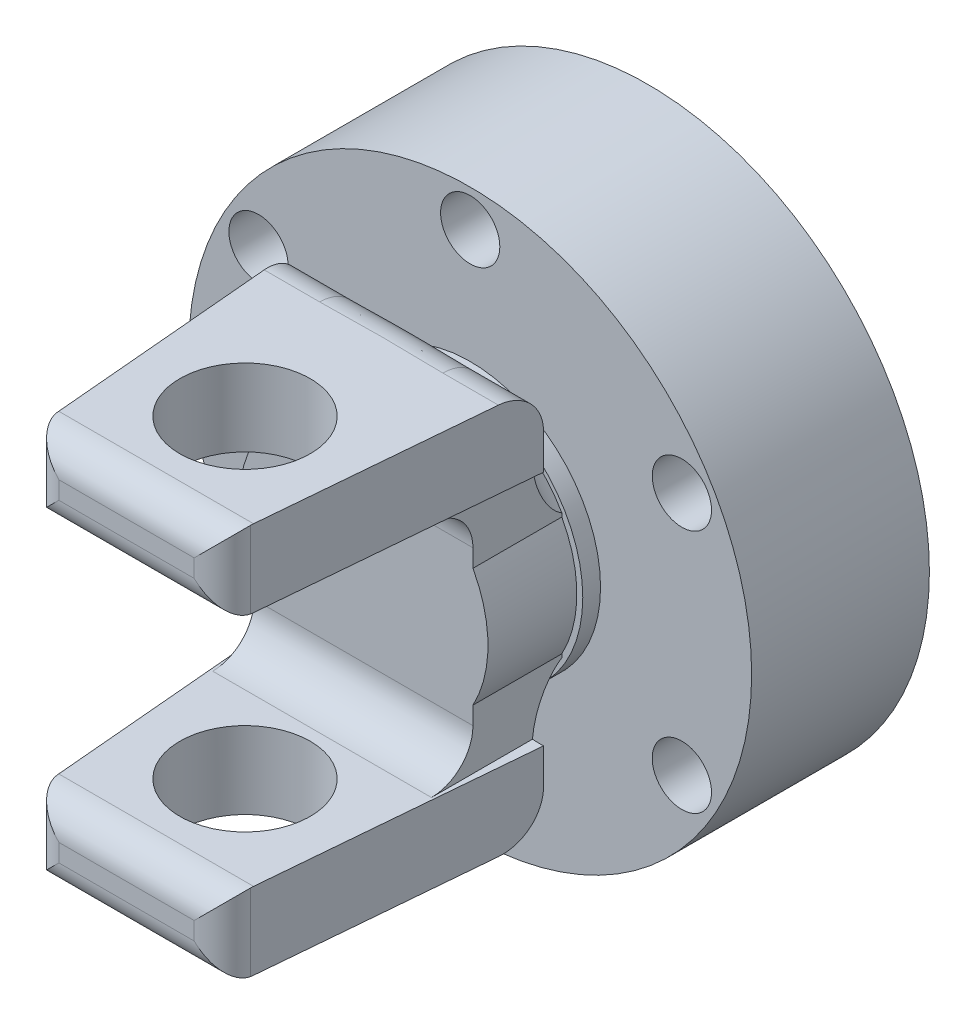
from build123d import *

# Parameters (mm, degrees)
SZKIC1_R                    = 47.5
DODANIE_WYCI_GNI_CIE1_DEPTH = 30
WYTNIJ_WYCI_GNI_CIE1_REACH  = 75.57
SZKIC2_R                    = 5
SZYK_KO_OWY1_COUNT          = 6
SZKIC3_R                    = 21
DODANIE_WYCI_GNI_CIE2_DEPTH = 0.001
SZKIC5_R                    = 22
DODANIE_WYCI_GNI_CIE4_DEPTH = 3
SZKIC7_R                    = 21
DODANIE_WYCI_GNI_CIE5_DEPTH = 15
DODANIE_WYCI_GNI_CIE6_DEPTH = 6.5
SZKIC14_W                   = 36.932370626
SZKIC14_H                   = 10
DODANIE_WYCI_GNI_CIE7_DEPTH = 10
ZAOKR_GLENIE1_R             = 7
ZAOKR_GLENIE2_R             = 7
ZAOKR_GLENIE3_R             = 5
WYTNIJ_WYCI_GNI_CIE2_REACH  = 130.377
SZKIC16_R                   = 11


# Read off the part's stored shape, not the designer's step: Lustro1
with BuildPart() as part:
    # Szkic1 → Dodanie-wyciągnięcie1 (new body)
    with BuildSketch(Plane.XY):
        Circle(SZKIC1_R)
    extrude(amount=DODANIE_WYCI_GNI_CIE1_DEPTH)

    # Szkic2 → Wytnij-wyciągnięcie1 (cut, up to next)
    with BuildSketch(Plane.XY.offset(30), mode=Mode.PRIVATE) as wytnij_wyci_gni_cie1_sk1:
        with Locations((0, 41.25)):
            Circle(SZKIC2_R)
    wytnij_wyci_gni_cie1_tool1 = extrude(wytnij_wyci_gni_cie1_sk1.sketch, amount=-WYTNIJ_WYCI_GNI_CIE1_REACH, mode=Mode.PRIVATE) & part.part
    wytnij_wyci_gni_cie1 = wytnij_wyci_gni_cie1_tool1.solids().sort_by_distance((0, 41.25, 30))[0]
    add(wytnij_wyci_gni_cie1, mode=Mode.SUBTRACT)

    # Szyk kołowy1: Wytnij-wyciągnięcie1 ×6 about axis
    szyk_ko_owy1_axis = Axis((0, 0, 0), (0, 0, 1))
    for i in range(1, SZYK_KO_OWY1_COUNT):
        add(wytnij_wyci_gni_cie1.rotate(szyk_ko_owy1_axis, i * 360 / SZYK_KO_OWY1_COUNT), mode=Mode.SUBTRACT)

    # Szkic3 → Dodanie-wyciągnięcie2 (add)
    with BuildSketch(Plane.XY.offset(30)):
        Circle(SZKIC3_R)
    extrude(amount=DODANIE_WYCI_GNI_CIE2_DEPTH)

    # Szkic5 → Dodanie-wyciągnięcie4 (add)
    with BuildSketch(Plane.XY.offset(30.001)):
        Circle(SZKIC5_R)
    extrude(amount=DODANIE_WYCI_GNI_CIE4_DEPTH)

    # Szkic7 → Dodanie-wyciągnięcie5 (add)
    with BuildSketch(Plane.XY.offset(33.001)):
        Circle(SZKIC7_R)
    extrude(amount=DODANIE_WYCI_GNI_CIE5_DEPTH)

    # Szkic9 → Dodanie-wyciągnięcie6 (add, symmetric)
    with BuildSketch(Plane(origin=(0, 26.5, 0), x_dir=(1, 0, 0), z_dir=(0, 1, 0))):
        Polygon((-20.374433176, -38.001), (-16, -88.001), (16, -88.001), (20.374433176, -38.001), align=None)
    extrude(amount=DODANIE_WYCI_GNI_CIE6_DEPTH, both=True)

    # Szkic14 → Dodanie-wyciągnięcie7 (add)
    with BuildSketch(Plane(origin=(0, 10, 0), x_dir=(1, 0, 0), z_dir=(0, 1, 0))):
        with Locations((0, -43.001)):
            Rectangle(SZKIC14_W, SZKIC14_H)
    extrude(amount=DODANIE_WYCI_GNI_CIE7_DEPTH)

    # Zaokrąglenie1
    # the kernel refuses this fillet: 7 mm, written as the material it adds along each edge
    with BuildSketch(Plane(origin=(0, 0, 38.001), x_dir=(-0.9435381877974668, -0.33126377430662785, 0), z_dir=(0.33126377430662785, -0.9435381877974668, 0))) as zaokr_glenie1_piece_1_section:
        with BuildLine():
            CenterArc((21 + ZAOKR_GLENIE1_R, ZAOKR_GLENIE1_R), ZAOKR_GLENIE1_R, 180, 90)
            Line((21 + ZAOKR_GLENIE1_R, 0), (21, 0))
            Line((21, 0), (21, ZAOKR_GLENIE1_R))
        make_face()
    zaokr_glenie1_piece_1 = revolve(axis=Axis((0, 0, 38.001), (0, 0, -1)), revolution_arc=218.690998802, mode=Mode.PRIVATE)
    zaokr_glenie1_piece_1 = split(zaokr_glenie1_piece_1, bisect_by=Plane(origin=(-18.694483681, 20, 37.992305912), z_dir=(0, 1, 0)), keep=Keep.TOP, mode=Mode.PRIVATE)
    add(zaokr_glenie1_piece_1)
    with BuildSketch(Plane(origin=(0, 0, 38.001), x_dir=(-0.9435381877974668, -0.33126377430662785, 0), z_dir=(0.33126377430662785, -0.9435381877974668, 0))) as zaokr_glenie1_piece_2_section:
        with BuildLine():
            CenterArc((21 + ZAOKR_GLENIE1_R, ZAOKR_GLENIE1_R), ZAOKR_GLENIE1_R, 180, 90)
            Line((21 + ZAOKR_GLENIE1_R, 0), (21, 0))
            Line((21, 0), (21, ZAOKR_GLENIE1_R))
        make_face()
    zaokr_glenie1_piece_2 = revolve(axis=Axis((0, 0, 38.001), (0, 0, -1)), revolution_arc=218.690998802, mode=Mode.PRIVATE)
    zaokr_glenie1_piece_2 = split(zaokr_glenie1_piece_2, bisect_by=Plane(origin=(-18.466185313, 16.543060956, 36.276393693), z_dir=(1, 0, 0)), keep=Keep.TOP, mode=Mode.PRIVATE)
    zaokr_glenie1_piece_2 = split(zaokr_glenie1_piece_2, bisect_by=Plane(origin=(18.466185313, 16.543060956, 36.276393693), z_dir=(-1, 0, 0)), keep=Keep.TOP, mode=Mode.PRIVATE)
    add(zaokr_glenie1_piece_2)
    with BuildSketch(Plane(origin=(18.466185313, 20, 48.001), x_dir=(0, 0, 1), z_dir=(-1, 0, 0))) as zaokr_glenie1_piece_3:
        with BuildLine():
            CenterArc((ZAOKR_GLENIE1_R, -ZAOKR_GLENIE1_R), ZAOKR_GLENIE1_R, 90, 90)
            Line((0, -ZAOKR_GLENIE1_R), (0, 0))
            Line((0, 0), (ZAOKR_GLENIE1_R, 0))
        make_face()
    extrude(amount=36.932370625)

    # Zaokrąglenie2
    zaokr_glenie2_edges = [part.edges().sort_by_distance(p)[0] for p in [
        (0, 33, 38.001),
    ]]
    fillet(zaokr_glenie2_edges, radius=ZAOKR_GLENIE2_R)

    # Zaokrąglenie3
    zaokr_glenie3_edges = [part.edges().sort_by_distance(p)[0] for p in [
        (0, 20, 88.001),
        (-16, 26.5, 88.001),
        (16, 26.5, 88.001),
        (0, 33, 88.001),
    ]]
    fillet(zaokr_glenie3_edges, radius=ZAOKR_GLENIE3_R)

    # Szkic16 → Wytnij-wyciągnięcie2 (cut, up to next)
    with BuildSketch(Plane(origin=(0, 33, 0), x_dir=(1, 0, 0), z_dir=(0, 1, 0)), mode=Mode.PRIVATE) as wytnij_wyci_gni_cie2_sk1:
        with Locations(Location((0, -68.001, 0), (0, 0, 270))):
            Circle(SZKIC16_R)
    wytnij_wyci_gni_cie2_tool1 = extrude(wytnij_wyci_gni_cie2_sk1.sketch, amount=-WYTNIJ_WYCI_GNI_CIE2_REACH, mode=Mode.PRIVATE) & part.part
    add(wytnij_wyci_gni_cie2_tool1.solids().sort_by_distance((0, 33, 68.001))[0], mode=Mode.SUBTRACT)

    # Lustro1: part across plane


with BuildPart() as part_1:
    add(part.part)
    add(part.part.mirror(Plane.ZX))


solid = part_1.part
